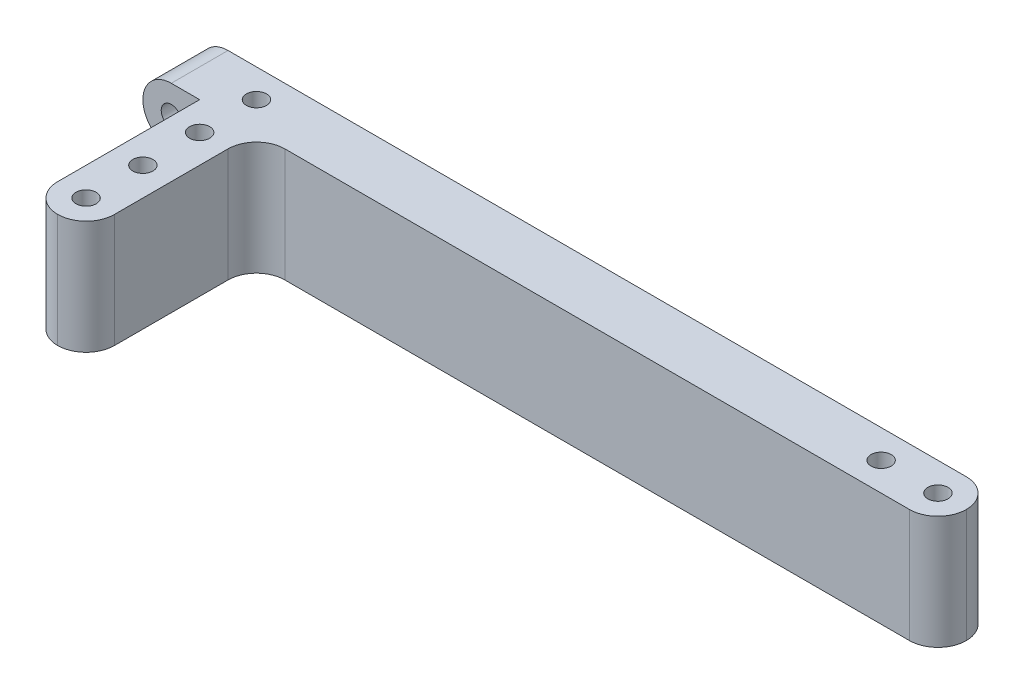
from build123d import *

# Parameters (mm, degrees)
SKETCH1_R           = 2.25
BOSS_EXTRUDE1_DEPTH = 25.4
SKETCH2_R           = 2.25
SKETCH2_W           = 12.7
SKETCH2_H           = 12.7
CUT_EXTRUDE1_DEPTH  = 12.7
FILLET1_R           = 6.35
FILLET2_R           = 6.35


with BuildPart() as part:
    # Sketch1 → Boss-Extrude1 (new body)
    with BuildSketch(Plane(origin=(0, 0, 0), x_dir=(1, 0, 0), z_dir=(0, 1, 0))):
        Polygon((158.75, 44.45), (158.75, 31.75), (6.35, 31.75), (6.35, -6.35), (-6.35, -6.35), (-6.35, 31.75), (-19.05, 31.75), (-19.05, 44.45), align=None)
        with Locations(Location((0, 38.1, 0), (0, 0, 270))):
            Circle(SKETCH1_R, mode=Mode.SUBTRACT)
        with Locations(Location((152.4, 38.1, 0), (0, 0, 270))):
            Circle(SKETCH1_R, mode=Mode.SUBTRACT)
        with Locations(Location((139.7, 38.1, 0), (0, 0, 270))):
            Circle(SKETCH1_R, mode=Mode.SUBTRACT)
        with Locations(Location((0, 25.4, 0), (0, 0, 270))):
            Circle(SKETCH1_R, mode=Mode.SUBTRACT)
        with Locations(Location((0, 12.7, 0), (0, 0, 270))):
            Circle(SKETCH1_R, mode=Mode.SUBTRACT)
        with Locations(Location((0, 0, 0), (0, 0, 270))):
            Circle(SKETCH1_R, mode=Mode.SUBTRACT)
    extrude(amount=BOSS_EXTRUDE1_DEPTH)

    # Sketch2 → Cut-Extrude1 (cut)
    with BuildSketch(Plane.XY.offset(-31.75)):
        with Locations((-12.7, 19.05)):
            Circle(SKETCH2_R)
        with Locations((-12.7, 6.35)):
            Rectangle(SKETCH2_W, SKETCH2_H)
    extrude(amount=-CUT_EXTRUDE1_DEPTH, mode=Mode.SUBTRACT)

    # Fillet1
    fillet1_edges = [part.edges().sort_by_distance(p)[0] for p in [
        (158.75, 12.7, -44.45),
        (158.75, 12.7, -31.75),
        (6.35, 12.7, 6.35),
        (-6.35, 12.7, 6.35),
        (-6.35, 6.35, -44.45),
        (6.35, 12.7, -31.75),
        (-19.05, 12.7, -38.1),
        (-19.05, 25.4, -38.1),
    ]]
    fillet(fillet1_edges, radius=FILLET1_R - 0.0001)  # a hair under: the kernel refuses the full size

    # Fillet2
    fillet2_edges = [part.edges().sort_by_distance(p)[0] for p in [
        (-4.49015735, 12.7, -42.59015735),
        (-6.35, 12.7, -34.92505),
    ]]
    fillet(fillet2_edges, radius=FILLET2_R)


solid = part.part
